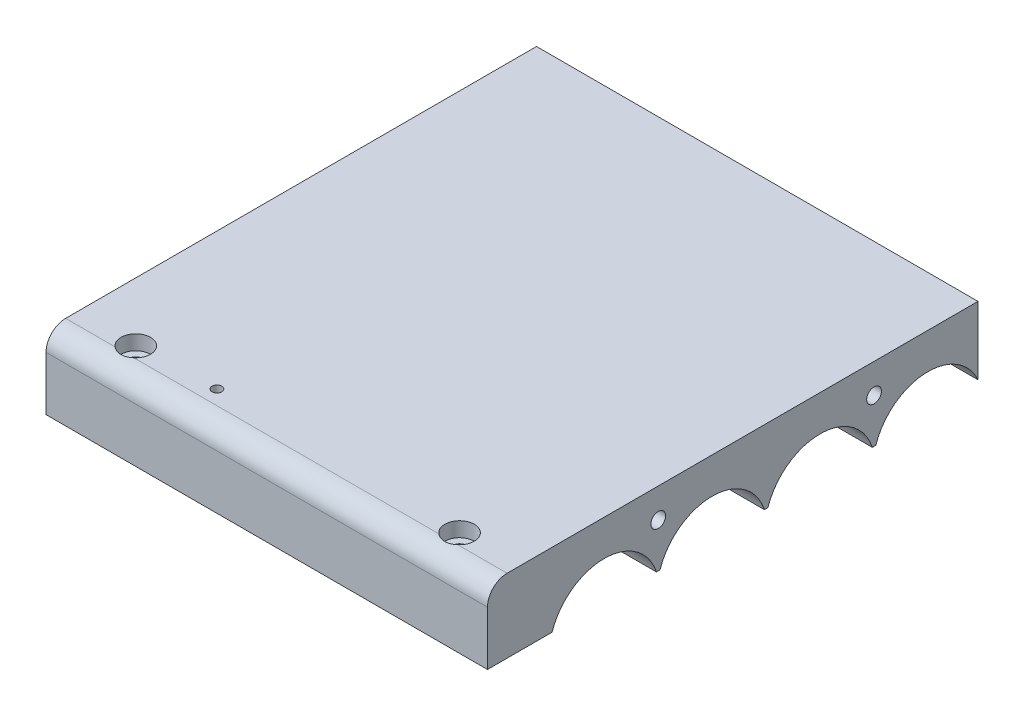
from build123d import *

# Parameters (mm, degrees)
SKETCH_1_W          = 70
SKETCH_1_H          = 110
EXTRUDE_1_DEPTH     = 5
EXTRUDE_2_DEPTH     = 70
CUT_EXTRUDE_1_DEPTH = 70
SKETCH_4_W          = 12.81
SKETCH_4_H          = 10
EXTRUDE_3_DEPTH     = 70
SKETCH_5_W          = 10
SKETCH_5_H          = 15
CUT_EXTRUDE_2_DEPTH = 70
CUT_EXTRUDE_3_REACH = 124.474
SKETCH_6_R          = 11.2
SKETCH_7_R          = 1.5
CUT_EXTRUDE_4_DEPTH = 10
EXTRUDE_4_DEPTH     = 20
SKETCH_9_R          = 1.5
CUT_EXTRUDE_5_DEPTH = 10
CUT_EXTRUDE_6_REACH = 124.984
SKETCH_10_R         = 1.5
SKETCH_11_R         = 3
CUT_EXTRUDE_7_DEPTH = 3
CUT_EXTRUDE_8_REACH = 124.984
SKETCH_12_R         = 1
FILLET_1_R          = 4
SKETCH_13_R         = 1.5
CUT_EXTRUDE_9_DEPTH = 10


with BuildPart() as part:
    # 草图1 → 凸台-拉伸1 (new body)
    with BuildSketch(Plane(origin=(0, 0, 0), x_dir=(1, 0, 0), z_dir=(0, 1, 0))):
        with Locations((35, 55)):
            Rectangle(SKETCH_1_W, SKETCH_1_H)
    extrude(amount=EXTRUDE_1_DEPTH)

    # 草图2 → 凸台-拉伸2 (add)
    with BuildSketch(Plane.ZY):
        with BuildLine():
            Line((-110, -13.499982039), (-100.81, -13.499982039))
            ThreePointArc((-100.81, -13.499982039), (-89.81, -2.499982039), (-78.81, -13.499982039))
            ThreePointArc((-78.81, -13.499982039), (-67.81, -2.499982039), (-56.81, -13.499982039))
            ThreePointArc((-56.81, -13.499982039), (-45.81, -2.499982039), (-34.81, -13.499982039))
            ThreePointArc((-34.81, -13.499982039), (-23.81, -2.499982039), (-12.81, -13.499982039))
            Line((-12.81, -13.499982039), (-12.81, 0))
            Line((-12.81, 0), (-110, 0))
            Line((-110, 0), (-110, -13.499982039))
        make_face()
    extrude(amount=-EXTRUDE_2_DEPTH)

    # 草图3 → 切除-拉伸1 (cut)
    with BuildSketch(Plane.ZY):
        with BuildLine():
            Line((-100.238332835, -10), (-110, -10))
            Line((-110, -10), (-110, -13.499982039))
            Line((-110, -13.499982039), (-100.81, -13.499982039))
            ThreePointArc((-100.81, -13.499982039), (-100.666142528, -11.726801449), (-100.238332835, -10))
        make_face()
        with BuildLine():
            Line((-78.238332835, -10), (-79.381667165, -10))
            ThreePointArc((-79.381667165, -10), (-78.953857472, -11.726801449), (-78.81, -13.499982039))
            ThreePointArc((-78.81, -13.499982039), (-78.666142528, -11.726801449), (-78.238332835, -10))
        make_face()
        with BuildLine():
            Line((-56.238332835, -10), (-57.381667165, -10))
            ThreePointArc((-57.381667165, -10), (-56.953857472, -11.726801449), (-56.81, -13.499982039))
            ThreePointArc((-56.81, -13.499982039), (-56.666142528, -11.726801449), (-56.238332835, -10))
        make_face()
        with BuildLine():
            Line((-12.81, -13.499982039), (-12.81, -10))
            Line((-12.81, -10), (-13.381667165, -10))
            ThreePointArc((-13.381667165, -10), (-12.953857472, -11.726801449), (-12.81, -13.499982039))
        make_face()
        with BuildLine():
            Line((-34.238332835, -10), (-35.381667165, -10))
            ThreePointArc((-35.381667165, -10), (-34.953857472, -11.726801449), (-34.81, -13.499982039))
            ThreePointArc((-34.81, -13.499982039), (-34.666142528, -11.726801449), (-34.238332835, -10))
        make_face()
    extrude(amount=-CUT_EXTRUDE_1_DEPTH, mode=Mode.SUBTRACT)

    # 草图4 → 凸台-拉伸3 (add)
    with BuildSketch(Plane.ZY):
        with Locations((-6.405, -5)):
            Rectangle(SKETCH_4_W, SKETCH_4_H)
    extrude(amount=-EXTRUDE_3_DEPTH)

    # 草图5 → 切除-拉伸2 (cut)
    with BuildSketch(Plane.ZY):
        with Locations((-105, -2.5)):
            Rectangle(SKETCH_5_W, SKETCH_5_H)
    extrude(amount=-CUT_EXTRUDE_2_DEPTH, mode=Mode.SUBTRACT)

    # 草图6 → 切除-拉伸3 (cut, up to next)
    with BuildSketch(Plane.ZY, mode=Mode.PRIVATE) as cut_extrude_3_sk1:
        with Locations((-89.81, -13.499982039)):
            Circle(SKETCH_6_R)
    cut_extrude_3_tool1 = extrude(cut_extrude_3_sk1.sketch, amount=-CUT_EXTRUDE_3_REACH, mode=Mode.PRIVATE) & part.part
    # 草图6 → 切除-拉伸3 (cut, up to next)
    with BuildSketch(Plane.ZY, mode=Mode.PRIVATE) as cut_extrude_3_sk2:
        with Locations((-67.81, -13.499982039)):
            Circle(SKETCH_6_R)
    cut_extrude_3_tool2 = extrude(cut_extrude_3_sk2.sketch, amount=-CUT_EXTRUDE_3_REACH, mode=Mode.PRIVATE) & part.part
    # 草图6 → 切除-拉伸3 (cut, up to next)
    with BuildSketch(Plane.ZY, mode=Mode.PRIVATE) as cut_extrude_3_sk3:
        with Locations((-45.81, -13.499982039)):
            Circle(SKETCH_6_R)
    cut_extrude_3_tool3 = extrude(cut_extrude_3_sk3.sketch, amount=-CUT_EXTRUDE_3_REACH, mode=Mode.PRIVATE) & part.part
    # 草图6 → 切除-拉伸3 (cut, up to next)
    with BuildSketch(Plane.ZY, mode=Mode.PRIVATE) as cut_extrude_3_sk4:
        with Locations((-23.81, -13.499982039)):
            Circle(SKETCH_6_R)
    cut_extrude_3_tool4 = extrude(cut_extrude_3_sk4.sketch, amount=-CUT_EXTRUDE_3_REACH, mode=Mode.PRIVATE) & part.part
    add(cut_extrude_3_tool1.solids().sort_by_distance((0, -13.499982, -89.81))[0], mode=Mode.SUBTRACT)
    add(cut_extrude_3_tool2.solids().sort_by_distance((0, -13.499982, -67.81))[0], mode=Mode.SUBTRACT)
    add(cut_extrude_3_tool3.solids().sort_by_distance((0, -13.499982, -45.81))[0], mode=Mode.SUBTRACT)
    add(cut_extrude_3_tool4.solids().sort_by_distance((0, -13.499982, -23.81))[0], mode=Mode.SUBTRACT)

    # 草图7 → 切除-拉伸4 (cut)
    with BuildSketch(Plane(origin=(70, 0, 0), x_dir=(0, 0, -1), z_dir=(1, 0, 0))):
        with Locations((78.81000898, -1)):
            Circle(SKETCH_7_R)
        with Locations((34.81000898, -1)):
            Circle(SKETCH_7_R)
    extrude(amount=-CUT_EXTRUDE_4_DEPTH, mode=Mode.SUBTRACT)

    # 草图8 → 凸台-拉伸4 (add)
    with BuildSketch(Plane.ZY):
        Polygon((0, 5), (-100, 5), (-100, -2.299982039), (-12.61, -2.299982039), (-12.61, -10), (0, -10), (0, -2.299982039), align=None)
    extrude(amount=EXTRUDE_4_DEPTH)

    # 草图9 → 切除-拉伸5 (cut)
    with BuildSketch(Plane(origin=(0, 0, -100), x_dir=(-1, 0, 0), z_dir=(0, 0, -1))):
        with Locations((-58, 1.35000898)):
            Circle(SKETCH_9_R)
        with Locations((8, 1.35000898)):
            Circle(SKETCH_9_R)
    extrude(amount=-CUT_EXTRUDE_5_DEPTH, mode=Mode.SUBTRACT)

    # 草图10 → 切除-拉伸6 (cut, up to next)
    with BuildSketch(Plane(origin=(0, 5, 0), x_dir=(1, 0, 0), z_dir=(0, 1, 0)), mode=Mode.PRIVATE) as cut_extrude_6_sk1:
        with Locations(Location((-8, 6.305, 0), (0, 0, 270))):
            Circle(SKETCH_10_R)
    cut_extrude_6_tool1 = extrude(cut_extrude_6_sk1.sketch, amount=-CUT_EXTRUDE_6_REACH, mode=Mode.PRIVATE) & part.part
    # 草图10 → 切除-拉伸6 (cut, up to next)
    with BuildSketch(Plane(origin=(0, 5, 0), x_dir=(1, 0, 0), z_dir=(0, 1, 0)), mode=Mode.PRIVATE) as cut_extrude_6_sk2:
        with Locations(Location((58, 6.305, 0), (0, 0, 270))):
            Circle(SKETCH_10_R)
    cut_extrude_6_tool2 = extrude(cut_extrude_6_sk2.sketch, amount=-CUT_EXTRUDE_6_REACH, mode=Mode.PRIVATE) & part.part
    add(cut_extrude_6_tool1.solids().sort_by_distance((-8, 5, -6.305))[0], mode=Mode.SUBTRACT)
    add(cut_extrude_6_tool2.solids().sort_by_distance((58, 5, -6.305))[0], mode=Mode.SUBTRACT)

    # 草图11 → 切除-拉伸7 (cut)
    with BuildSketch(Plane(origin=(0, 5, 0), x_dir=(1, 0, 0), z_dir=(0, 1, 0))):
        with Locations(Location((-8, 6.305, 0), (0, 0, 270))):
            Circle(SKETCH_11_R)
        with Locations(Location((58, 6.305, 0), (0, 0, 270))):
            Circle(SKETCH_11_R)
    extrude(amount=-CUT_EXTRUDE_7_DEPTH, mode=Mode.SUBTRACT)

    # 草图12 → 切除-拉伸8 (cut, up to next)
    with BuildSketch(Plane(origin=(0, 5, 0), x_dir=(1, 0, 0), z_dir=(0, 1, 0)), mode=Mode.PRIVATE) as cut_extrude_8_sk1:
        with Locations(Location((7.891, 6.943325734, 0), (0, 0, 270))):
            Circle(SKETCH_12_R)
    cut_extrude_8_tool1 = extrude(cut_extrude_8_sk1.sketch, amount=-CUT_EXTRUDE_8_REACH, mode=Mode.PRIVATE) & part.part
    add(cut_extrude_8_tool1.solids().sort_by_distance((7.891, 5, -6.943326))[0], mode=Mode.SUBTRACT)

    # 圆角1
    # the kernel refuses this fillet: 4 mm, written as the material it takes off along each edge
    with BuildSketch(Plane(origin=(80, 5, 0), x_dir=(0, -1, 0), z_dir=(-1, 0, 0))) as fillet_1_piece_1:
        with BuildLine():
            CenterArc((FILLET_1_R, -FILLET_1_R), FILLET_1_R, 90, 90)
            Line((0, -FILLET_1_R), (0, 0))
            Line((0, 0), (FILLET_1_R, 0))
        make_face()
    extrude(amount=110, mode=Mode.SUBTRACT)

    # 草图13 → 切除-拉伸9 (cut)
    with BuildSketch(Plane.ZY.offset(20)):
        with Locations((-55, 1.35000898)):
            Circle(SKETCH_13_R)
    extrude(amount=-CUT_EXTRUDE_9_DEPTH, mode=Mode.SUBTRACT)


solid = part.part
